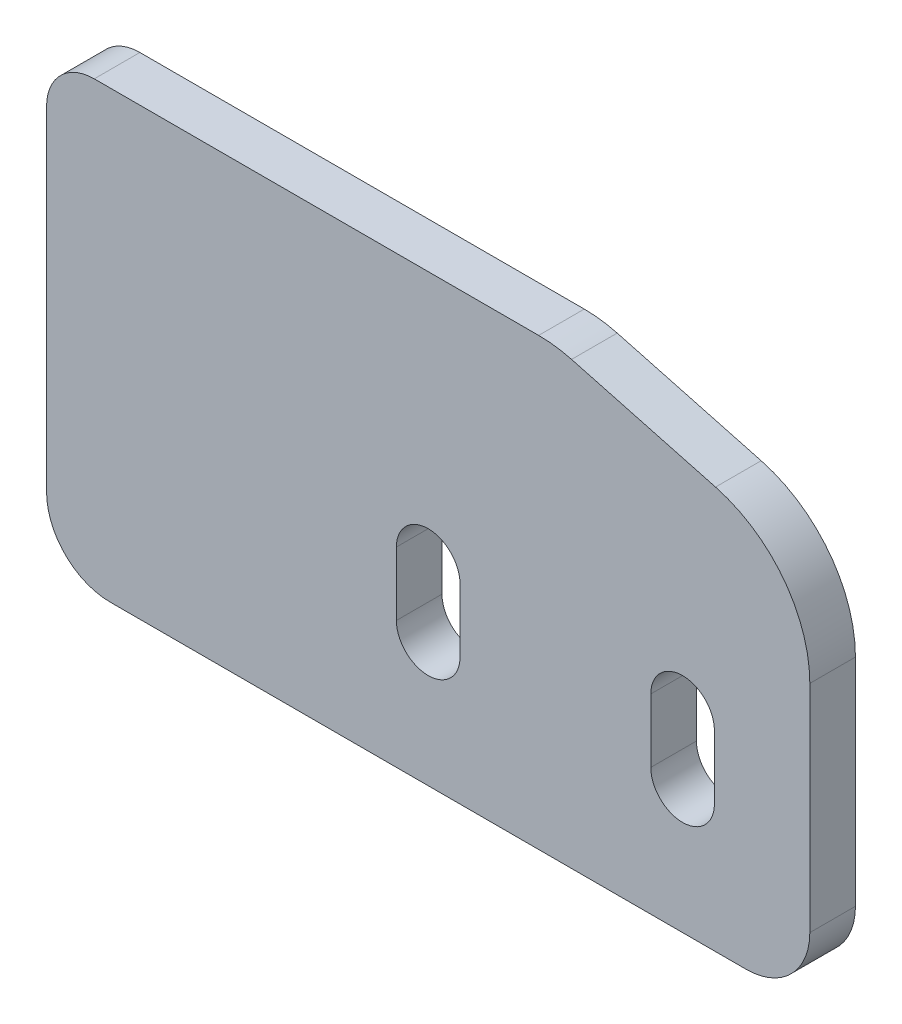
from build123d import *

# Parameters (mm, degrees)
SKETCH1_W          = 76.2
SKETCH1_H          = 44.45
BASE_FLANGE1_DEPTH = 4.55422
CUT_EXTRUDE1_DEPTH = 45.342998825
FILLET1_R          = 4.7625
FILLET2_R          = 12.7
SKETCH3_R          = 3.175
CUT_EXTRUDE2_DEPTH = 45.342998825
FILLET3_R          = 6.35
CUT_EXTRUDE3_DEPTH = 45.342998825


# Sheet-metal steps are written as plain solids
with BuildPart() as part:
    # Sketch1 → Base-Flange1 (new body)
    with BuildSketch(Plane.XY):
        Rectangle(SKETCH1_W, SKETCH1_H)
    extrude(amount=BASE_FLANGE1_DEPTH)

    # Sketch2 → Cut-Extrude1 (cut, through all)
    with BuildSketch(Plane.XY.offset(4.55422)):
        Polygon((12.7, 22.225), (38.1, 15.419090512), (38.1, 22.225), align=None)
    extrude(amount=-CUT_EXTRUDE1_DEPTH, mode=Mode.SUBTRACT)

    # Fillet1
    fillet1_edges = [part.edges().sort_by_distance(p)[0] for p in [
        (-38.1, 22.225, 2.27711),
    ]]
    fillet(fillet1_edges, radius=FILLET1_R)

    # Fillet2
    fillet2_edges = [part.edges().sort_by_distance(p)[0] for p in [
        (12.7, 22.225, 2.27711),
        (38.1, 15.419090512, 2.27711),
    ]]
    fillet(fillet2_edges, radius=FILLET2_R)

    # Sketch3 → Cut-Extrude2 (cut, through all)
    with BuildSketch(Plane.XY.offset(4.55422)):
        with Locations((0, -9.525)):
            Circle(SKETCH3_R)
        with Locations((25.4, -9.525)):
            Circle(SKETCH3_R)
    extrude(amount=-CUT_EXTRUDE2_DEPTH, mode=Mode.SUBTRACT)

    # Fillet3
    fillet3_edges = [part.edges().sort_by_distance(p)[0] for p in [
        (38.1, -22.225, 2.27711),
        (-38.1, -22.225, 2.27711),
    ]]
    fillet(fillet3_edges, radius=FILLET3_R)

    # Sketch4 → Cut-Extrude3 (cut, through all)
    with BuildSketch(Plane.XY.offset(4.55422)):
        with BuildLine():
            Line((-3.175, -9.525), (-3.175, -3.175))
            ThreePointArc((-3.175, -3.175), (0, 0), (3.175, -3.175))
            Line((3.175, -3.175), (3.175, -9.525))
            ThreePointArc((3.175, -9.525), (0, -12.7), (-3.175, -9.525))
        make_face()
        with BuildLine():
            Line((22.225, -9.525), (22.225, -3.175))
            ThreePointArc((22.225, -3.175), (25.4, 0), (28.575, -3.175))
            Line((28.575, -3.175), (28.575, -9.525))
            ThreePointArc((28.575, -9.525), (25.4, -12.7), (22.225, -9.525))
        make_face()
    extrude(amount=-CUT_EXTRUDE3_DEPTH, mode=Mode.SUBTRACT)


solid = part.part
